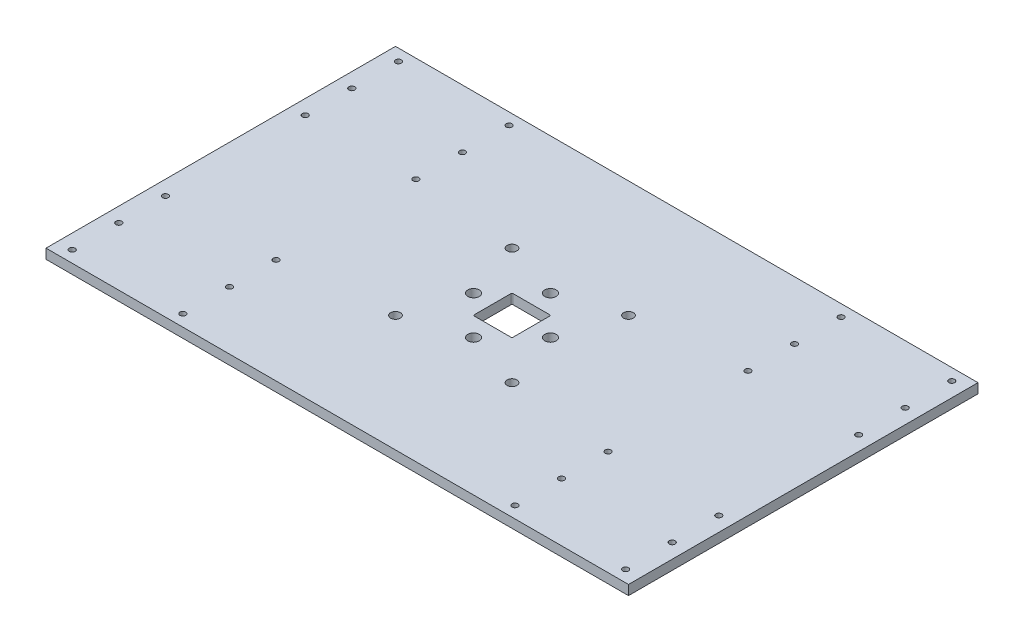
from build123d import *

# Parameters (mm, degrees)
SKETCH1_W           = 300
SKETCH1_H           = 180
SKETCH1_R           = 1.5
SKETCH1_R_2         = 2.95
SKETCH1_R_3         = 2.5
BOSS_EXTRUDE1_DEPTH = 5


with BuildPart() as part:
    # Sketch1 → Boss-Extrude1 (new body)
    with BuildSketch(Plane(origin=(0, 0, 0), x_dir=(1, 0, 0), z_dir=(0, 1, 0))):
        Rectangle(SKETCH1_W, SKETCH1_H)
        with Locations((-142.5, 84)):
            Circle(SKETCH1_R, mode=Mode.SUBTRACT)
        with Locations((-142.5, 60)):
            Circle(SKETCH1_R, mode=Mode.SUBTRACT)
        with Locations((-142.5, 36)):
            Circle(SKETCH1_R, mode=Mode.SUBTRACT)
        with Locations((-85.5, 84)):
            Circle(SKETCH1_R, mode=Mode.SUBTRACT)
        with Locations((-85.5, 60)):
            Circle(SKETCH1_R, mode=Mode.SUBTRACT)
        with Locations((-85.5, 36)):
            Circle(SKETCH1_R, mode=Mode.SUBTRACT)
        with Locations((85.5, 36)):
            Circle(SKETCH1_R, mode=Mode.SUBTRACT)
        with Locations((85.5, 60)):
            Circle(SKETCH1_R, mode=Mode.SUBTRACT)
        with Locations((85.5, 84)):
            Circle(SKETCH1_R, mode=Mode.SUBTRACT)
        with Locations((142.5, 36)):
            Circle(SKETCH1_R, mode=Mode.SUBTRACT)
        with Locations((142.5, 60)):
            Circle(SKETCH1_R, mode=Mode.SUBTRACT)
        with Locations((142.5, 84)):
            Circle(SKETCH1_R, mode=Mode.SUBTRACT)
        with Locations((142.5, -84)):
            Circle(SKETCH1_R, mode=Mode.SUBTRACT)
        with Locations((142.5, -60)):
            Circle(SKETCH1_R, mode=Mode.SUBTRACT)
        with Locations((142.5, -36)):
            Circle(SKETCH1_R, mode=Mode.SUBTRACT)
        with Locations((85.5, -84)):
            Circle(SKETCH1_R, mode=Mode.SUBTRACT)
        with Locations((85.5, -60)):
            Circle(SKETCH1_R, mode=Mode.SUBTRACT)
        with Locations((85.5, -36)):
            Circle(SKETCH1_R, mode=Mode.SUBTRACT)
        with Locations((-85.5, -36)):
            Circle(SKETCH1_R, mode=Mode.SUBTRACT)
        with Locations((-85.5, -60)):
            Circle(SKETCH1_R, mode=Mode.SUBTRACT)
        with Locations((-85.5, -84)):
            Circle(SKETCH1_R, mode=Mode.SUBTRACT)
        with Locations((-142.5, -36)):
            Circle(SKETCH1_R, mode=Mode.SUBTRACT)
        with Locations((-142.5, -60)):
            Circle(SKETCH1_R, mode=Mode.SUBTRACT)
        with Locations((-142.5, -84)):
            Circle(SKETCH1_R, mode=Mode.SUBTRACT)
        with Locations((0, 19.8)):
            Circle(SKETCH1_R_2, mode=Mode.SUBTRACT)
        with Locations((19.8, 0)):
            Circle(SKETCH1_R_2, mode=Mode.SUBTRACT)
        with Locations((0, -19.8)):
            Circle(SKETCH1_R_2, mode=Mode.SUBTRACT)
        with Locations((-19.8, 0)):
            Circle(SKETCH1_R_2, mode=Mode.SUBTRACT)
        with Locations((-30, -30)):
            Circle(SKETCH1_R_3, mode=Mode.SUBTRACT)
        with Locations((-30, 30)):
            Circle(SKETCH1_R_3, mode=Mode.SUBTRACT)
        with Locations((30, 30)):
            Circle(SKETCH1_R_3, mode=Mode.SUBTRACT)
        with Locations((30, -30)):
            Circle(SKETCH1_R_3, mode=Mode.SUBTRACT)
        with BuildLine():
            Line((-9.5, -10), (9.5, -10))
            ThreePointArc((9.5, -10), (9.853553391, -9.853553391), (10, -9.5))
            Line((10, -9.5), (10, 9.5))
            ThreePointArc((10, 9.5), (9.853553391, 9.853553391), (9.5, 10))
            Line((9.5, 10), (-9.5, 10))
            ThreePointArc((-9.5, 10), (-9.853553391, 9.853553391), (-10, 9.5))
            Line((-10, 9.5), (-10, -9.5))
            ThreePointArc((-10, -9.5), (-9.853553391, -9.853553391), (-9.5, -10))
        make_face(mode=Mode.SUBTRACT)
    extrude(amount=BOSS_EXTRUDE1_DEPTH)


solid = part.part
